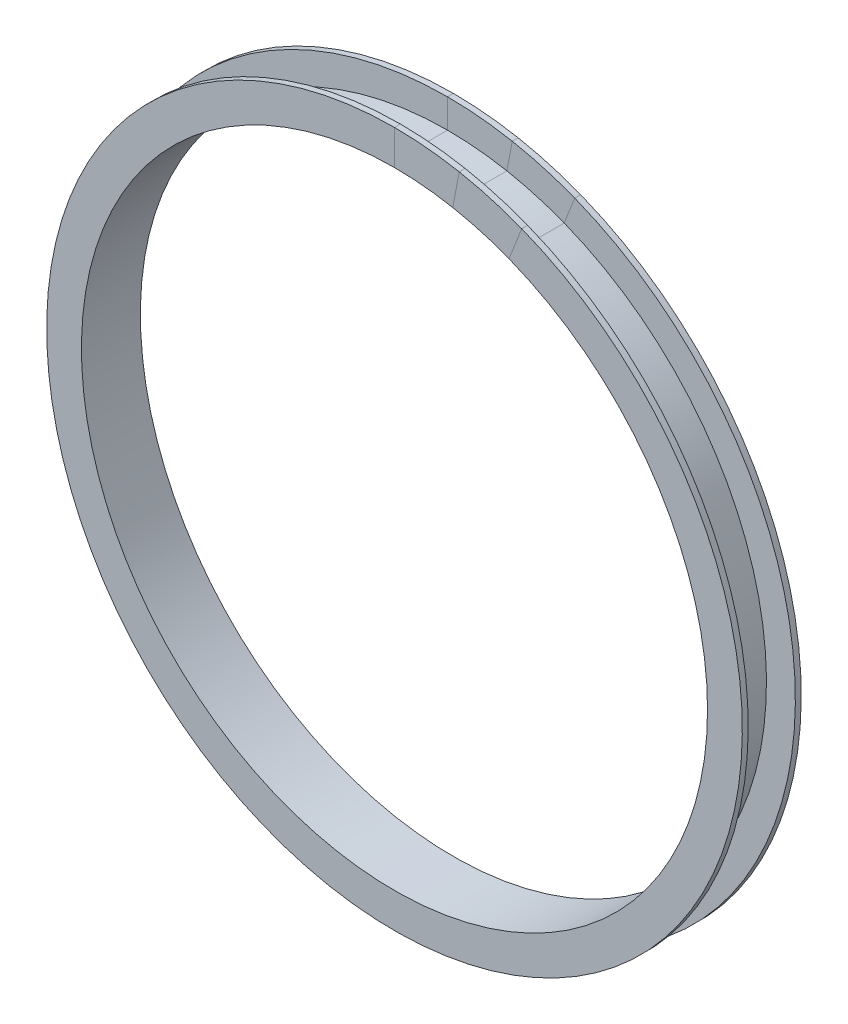
from build123d import *

# Parameters (mm, degrees)
SKETCH2_R           = 187.3885
SKETCH2_R_2         = 168.656
BOSS_EXTRUDE1_DEPTH = 3.175
SKETCH3_R           = 171.831
SKETCH3_R_2         = 168.656
BOSS_EXTRUDE2_DEPTH = 25.4
SKETCH4_R           = 187.3885
SKETCH4_R_2         = 168.656
BOSS_EXTRUDE3_DEPTH = 3.175
SPLIT3_DEPTH        = 31.75
SPLIT3_2_DEPTH      = 3.175
SPLIT3_START        = 28.575
SPLIT3_3_DEPTH      = 3.175
SPLIT3_4_DEPTH      = 31.75
SPLIT3_5_DEPTH      = 31.75
SPLIT3_6_DEPTH      = 3.175
SPLIT3_7_DEPTH      = 3.175


# Read off the part's stored shape, not the designer's step: Split3
with BuildPart() as part:
    # Sketch2 → Boss-Extrude1 (new body)
    with BuildSketch(Plane.XY):
        Circle(SKETCH2_R)
        Circle(SKETCH2_R_2, mode=Mode.SUBTRACT)
    extrude(amount=BOSS_EXTRUDE1_DEPTH)

    # Sketch3 → Boss-Extrude2 (add)
    with BuildSketch(Plane.XY.offset(3.175)):
        Circle(SKETCH3_R)
        Circle(SKETCH3_R_2, mode=Mode.SUBTRACT)
    extrude(amount=BOSS_EXTRUDE2_DEPTH)

    # Sketch4 → Boss-Extrude3 (add)
    with BuildSketch(Plane.XY.offset(28.575)):
        Circle(SKETCH4_R)
        Circle(SKETCH4_R_2, mode=Mode.SUBTRACT)
    extrude(amount=BOSS_EXTRUDE3_DEPTH)

    # Split3 4 outline → Split3 4 (cut)
    with BuildSketch(Plane.XY):
        with BuildLine():
            ThreePointArc((0, 168.656), (31.400557033, 165.707125236), (61.703064661, 156.963620459))
            Line((61.703064661, 156.963620459), (68.556379448, 174.397456315))
            ThreePointArc((68.556379448, 174.397456315), (34.888194203, 184.112095848), (0, 187.3885))
            Line((0, 187.3885), (0, 168.656))
        make_face()
    extrude(amount=SPLIT3_4_DEPTH, mode=Mode.SUBTRACT)


with BuildPart() as body_2:
    # Split3 outline → Split3 (new body)
    with BuildSketch(Plane.XY):
        with BuildLine():
            Line((0, 171.831), (0, 168.656))
            ThreePointArc((0, 168.656), (15.769359882, 167.917162985), (31.400557033, 165.707125236))
            Line((31.400557033, 165.707125236), (31.991681977, 168.826611781))
            ThreePointArc((31.991681977, 168.826611781), (16.066222832, 171.078254156), (0, 171.831))
        make_face()
    extrude(amount=SPLIT3_DEPTH)

    # Split3 2 outline → Split3 2 (add)
    with BuildSketch(Plane.XY):
        with BuildLine():
            Line((0, 187.3885), (0, 171.831))
            ThreePointArc((0, 171.831), (16.066222832, 171.078254156), (31.991681977, 168.826611781))
            Line((31.991681977, 168.826611781), (34.888194203, 184.112095848))
            ThreePointArc((34.888194203, 184.112095848), (17.520851284, 186.567600892), (0, 187.3885))
        make_face()
    extrude(amount=SPLIT3_2_DEPTH)

    # Split3 3 outline → Split3 3 (add)
    with BuildSketch(Plane.XY.offset(SPLIT3_START)):
        with BuildLine():
            Line((0, 187.3885), (0, 171.831))
            ThreePointArc((0, 171.831), (16.066222832, 171.078254156), (31.991681977, 168.826611781))
            Line((31.991681977, 168.826611781), (34.888194203, 184.112095848))
            ThreePointArc((34.888194203, 184.112095848), (17.520851284, 186.567600892), (0, 187.3885))
        make_face()
    extrude(amount=SPLIT3_3_DEPTH)


with BuildPart() as body_3:
    # Split3 5 outline → Split3 5 (new body)
    with BuildSketch(Plane.XY):
        with BuildLine():
            Line((31.991681977, 168.826611781), (31.400557033, 165.707125236))
            ThreePointArc((31.400557033, 165.707125236), (46.75663923, 162.045249927), (61.703064661, 156.963620459))
            Line((61.703064661, 156.963620459), (62.864643438, 159.918507892))
            ThreePointArc((62.864643438, 159.918507892), (47.636847047, 165.095800566), (31.991681977, 168.826611781))
        make_face()
    extrude(amount=SPLIT3_5_DEPTH)

    # Split3 6 outline → Split3 6 (add)
    with BuildSketch(Plane.XY):
        with BuildLine():
            Line((34.888194203, 184.112095848), (31.991681977, 168.826611781))
            ThreePointArc((31.991681977, 168.826611781), (47.636847047, 165.095800566), (62.864643438, 159.918507892))
            Line((62.864643438, 159.918507892), (68.556379448, 174.397456315))
            ThreePointArc((68.556379448, 174.397456315), (51.949865349, 180.043498695), (34.888194203, 184.112095848))
        make_face()
    extrude(amount=SPLIT3_6_DEPTH)

    # Split3 7 outline → Split3 7 (add)
    with BuildSketch(Plane.XY.offset(SPLIT3_START)):
        with BuildLine():
            Line((34.888194203, 184.112095848), (31.991681977, 168.826611781))
            ThreePointArc((31.991681977, 168.826611781), (47.636847047, 165.095800566), (62.864643438, 159.918507892))
            Line((62.864643438, 159.918507892), (68.556379448, 174.397456315))
            ThreePointArc((68.556379448, 174.397456315), (51.949865349, 180.043498695), (34.888194203, 184.112095848))
        make_face()
    extrude(amount=SPLIT3_7_DEPTH)


solid = Compound([part.part, body_2.part, body_3.part])
